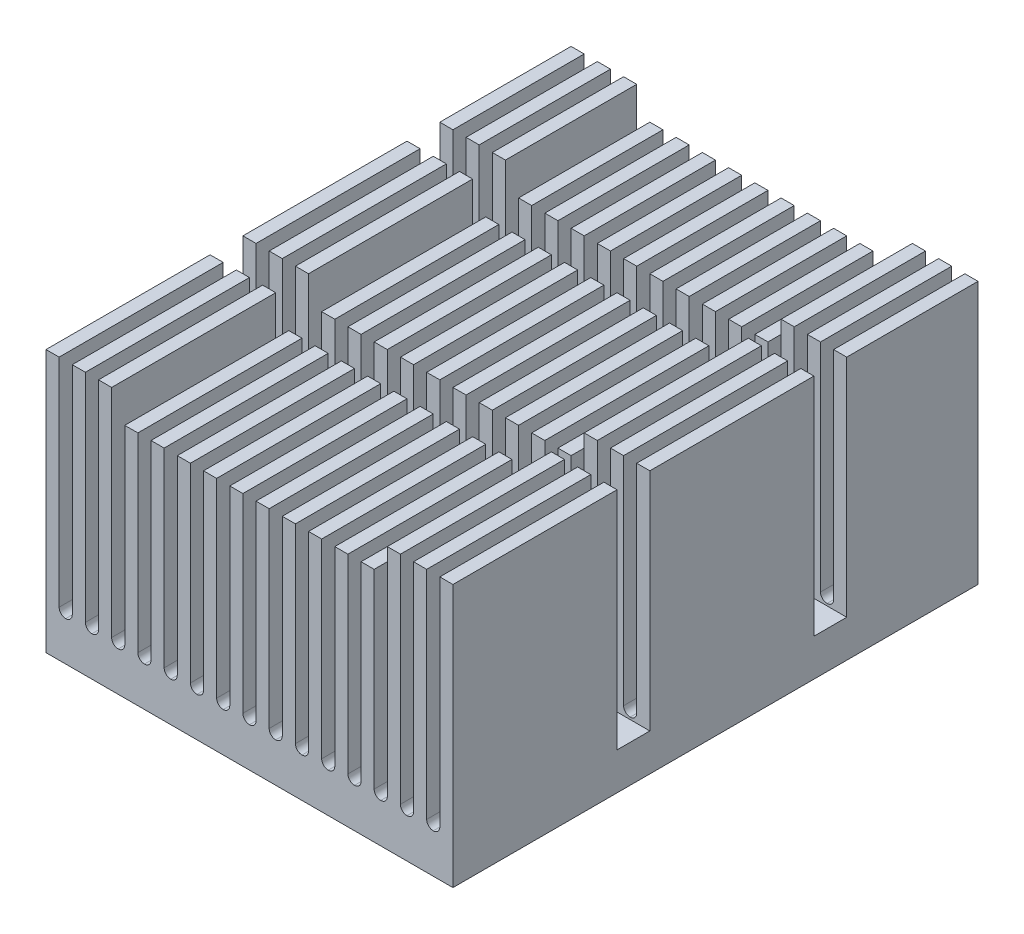
from build123d import *

# Parameters (mm, degrees)
SKETCH1_W              = 62
SKETCH1_H              = 40
BOSS_EXTRUDE1_DEPTH    = 40
SKETCH2_W              = 2
SKETCH2_H              = 34
CUT_EXTRUDE1_DEPTH     = 40
FILLET1_R              = 1
LPATTERN2_COUNT        = 15
LPATTERN2_PITCH        = 4
FILLET1_OF_LPATTERN2_R = 1
SKETCH4_W              = 40
SKETCH4_H              = 4
CUT_EXTRUDE2_DEPTH     = 40
SKETCH5_W              = 5
SKETCH5_H              = 34.328358209
CUT_EXTRUDE3_DEPTH     = 40


with BuildPart() as part:
    # Sketch1 → Boss-Extrude1 (new, symmetric)
    with BuildSketch(Plane.XY):
        with Locations((0, 22.067039801)):
            Rectangle(SKETCH1_W, SKETCH1_H)
    extrude(amount=BOSS_EXTRUDE1_DEPTH, both=True)

    # Sketch2 → Cut-Extrude1 (cut, symmetric)
    with BuildSketch(Plane.XY):
        with Locations((-28, 25.067039801)):
            Rectangle(SKETCH2_W, SKETCH2_H)
    cut_extrude1 = extrude(amount=CUT_EXTRUDE1_DEPTH, both=True, mode=Mode.SUBTRACT)

    # Fillet1
    fillet1_edges = [part.edges().sort_by_distance(p)[0] for p in [
        (-29, 8.067039801, 0),
        (-27, 8.067039801, 0),
    ]]
    fillet(fillet1_edges, radius=FILLET1_R - 0.0001)  # a hair under: the kernel refuses the full size

    # LPattern2: Cut-Extrude1 ×15
    with Locations(*[(i * LPATTERN2_PITCH, 0, 0) for i in range(1, LPATTERN2_COUNT)]):
        add(cut_extrude1, mode=Mode.SUBTRACT)

    # Fillet1 of LPattern2
    fillet1_of_lpattern2_edges = [part.edges().sort_by_distance(p)[0] for p in [
        (-25, 8.067039801, 0),
        (-23, 8.067039801, 0),
        (-21, 8.067039801, 0),
        (-19, 8.067039801, 0),
        (-17, 8.067039801, 0),
        (-15, 8.067039801, 0),
        (-13, 8.067039801, 0),
        (-11, 8.067039801, 0),
        (-9, 8.067039801, 0),
        (-7, 8.067039801, 0),
        (-5, 8.067039801, 0),
        (-3, 8.067039801, 0),
        (-1, 8.067039801, 0),
        (1, 8.067039801, 0),
        (3, 8.067039801, 0),
        (5, 8.067039801, 0),
        (7, 8.067039801, 0),
        (9, 8.067039801, 0),
        (11, 8.067039801, 0),
        (13, 8.067039801, 0),
        (15, 8.067039801, 0),
        (17, 8.067039801, 0),
        (19, 8.067039801, 0),
        (21, 8.067039801, 0),
        (23, 8.067039801, 0),
        (25, 8.067039801, 0),
        (27, 8.067039801, 0),
        (29, 8.067039801, 0),
    ]]
    fillet(fillet1_of_lpattern2_edges, radius=FILLET1_OF_LPATTERN2_R - 0.0001)  # a hair under: the kernel refuses the full size

    # Sketch4 → Cut-Extrude2 (cut, symmetric)
    with BuildSketch(Plane.XY):
        with Locations((0, 40.067039801)):
            Rectangle(SKETCH4_W, SKETCH4_H)
    extrude(amount=CUT_EXTRUDE2_DEPTH, both=True, mode=Mode.SUBTRACT)

    # Sketch5 → Cut-Extrude3 (cut, symmetric)
    with BuildSketch(Plane(origin=(0, 0, 0), x_dir=(0, 0, -1), z_dir=(1, 0, 0))):
        with Locations((-12.5, 24.902860696)):
            Rectangle(SKETCH5_W, SKETCH5_H)
        with Locations((17.5, 24.902860696)):
            Rectangle(SKETCH5_W, SKETCH5_H)
    extrude(amount=CUT_EXTRUDE3_DEPTH, both=True, mode=Mode.SUBTRACT)


solid = part.part
